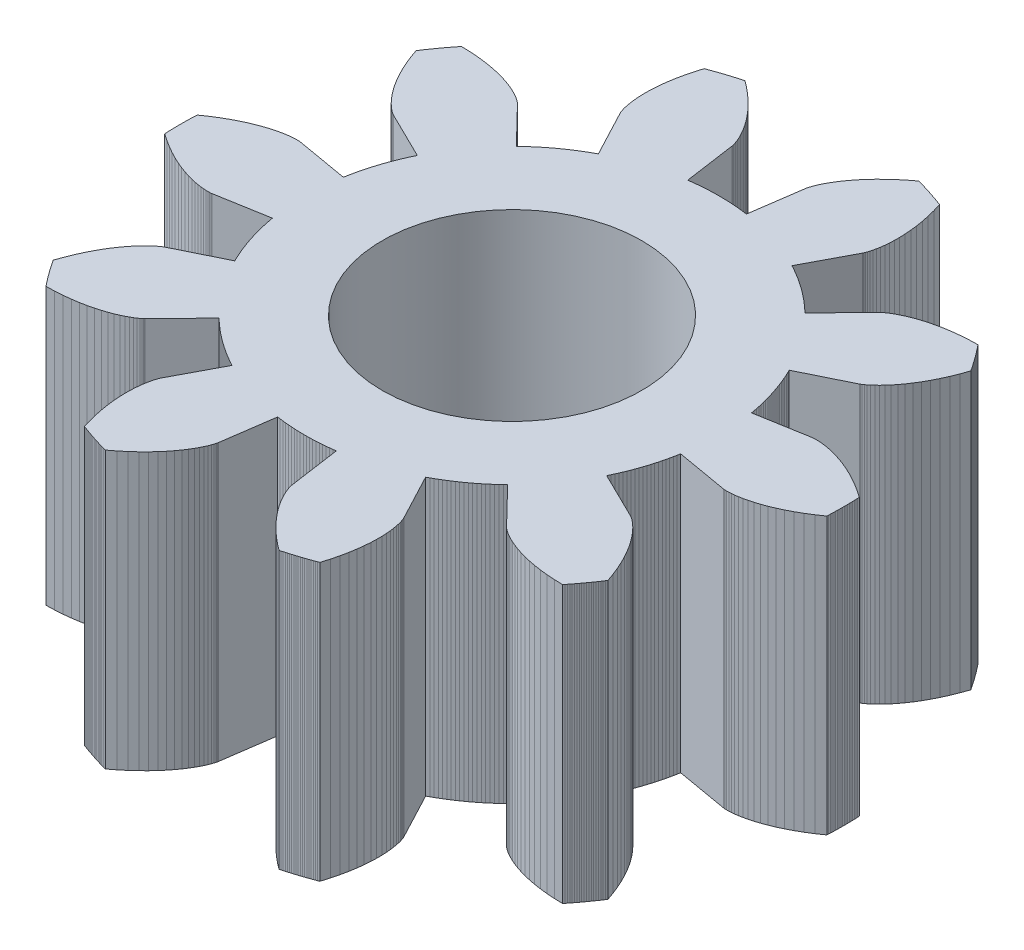
from build123d import *

# Parameters (mm, degrees)
BOSS_EXTRUDE1_DEPTH = 5
SKETCH2_R           = 2.35
CUT_EXTRUDE1_DEPTH  = 10.722497268


with BuildPart() as part:
    # Sketch1 → Boss-Extrude1 (new body)
    with BuildSketch(Plane(origin=(0, 0, 0), x_dir=(1, 0, 0), z_dir=(0, 1, 0))):
        Polygon((3.6946769, -0.6417654), (4.6291475, -0.8040829), (4.6332094, -0.8046724), (4.6454524, -0.8059869), (4.6659298, -0.8073423), (4.6946521, -0.8080515), (4.7315867, -0.8074275), (4.7766581, -0.8047855), (4.8297479, -0.7994452), (4.8906949, -0.7907331), (4.9592959, -0.7779854), (5.035306, -0.7605497), (5.1184393, -0.7377878), (5.2083696, -0.7090775), (5.3047313, -0.6738155), (5.4071205, -0.631419), (5.515096, -0.5813282), (5.6281806, -0.523008), (5.7458624, -0.4559506), (5.8675963, -0.379677), (5.9928055, -0.2937389), (5.9942402, -0.26284), (5.9955155, -0.2319341), (5.9966316, -0.201022), (5.9975882, -0.1701046), (5.9983855, -0.1391826), (5.9990233, -0.108257), (5.9995017, -0.0773285), (5.9998206, -0.0463979), (5.9999801, -0.0154661), (5.9999801, 0.0154661), (5.9998206, 0.0463979), (5.9995017, 0.0773285), (5.9990233, 0.108257), (5.9983855, 0.1391826), (5.9975882, 0.1701046), (5.9966316, 0.201022), (5.9955155, 0.2319341), (5.9942402, 0.26284), (5.9928055, 0.2937389), (5.8675963, 0.379677), (5.7458624, 0.4559506), (5.6281806, 0.523008), (5.515096, 0.5813282), (5.4071205, 0.631419), (5.3047313, 0.6738155), (5.2083696, 0.7090775), (5.1184393, 0.7377878), (5.035306, 0.7605497), (4.9592959, 0.7779854), (4.8906949, 0.7907331), (4.8297479, 0.7994452), (4.7766581, 0.8047855), (4.7315867, 0.8074275), (4.6946521, 0.8080515), (4.6659298, 0.8073423), (4.6454524, 0.8059869), (4.6332094, 0.8046724), (4.6291475, 0.8040829), (3.6946769, 0.6417654), (3.6846589, 0.6969853), (3.6738157, 0.7520491), (3.6621497, 0.8069445), (3.6496635, 0.8616591), (3.6363598, 0.9161808), (3.6222417, 0.9704972), (3.6073123, 1.0245963), (3.591575, 1.078466), (3.5750333, 1.132094), (3.5576909, 1.1854685), (3.5395516, 1.2385775), (3.5206196, 1.2914091), (3.5008991, 1.3439515), (3.4803944, 1.3961929), (3.4591103, 1.4481215), (3.4370514, 1.4997258), (3.4142227, 1.5509942), (3.3906294, 1.6019152), (3.3662766, 1.6524775), (4.217687, 2.0704279), (4.2213197, 2.0723385), (4.2319972, 2.0784713), (4.2493604, 2.0894111), (4.2730141, 2.1057199), (4.3025281, 2.1279343), (4.3374387, 2.156564), (4.3772502, 2.1920898), (4.4214365, 2.2349618), (4.469443, 2.2855975), (4.520688, 2.3443809), (4.5745651, 2.4116603), (4.6304448, 2.4877471), (4.6876766, 2.5729146), (4.7455911, 2.6673969), (4.8035025, 2.7713877), (4.8607101, 2.8850392), (4.9165014, 3.0084614), (4.9701537, 3.1417214), (5.0209369, 3.2848429), (5.0039356, 3.3106839), (4.9868014, 3.336437), (4.9695346, 3.3621014), (4.9521358, 3.3876764), (4.9346053, 3.4131614), (4.9169437, 3.4385557), (4.8991514, 3.4638585), (4.8812288, 3.4890694), (4.8631766, 3.5141875), (4.8449951, 3.5392121), (4.8266848, 3.5641428), (4.8082463, 3.5889787), (4.7896799, 3.6137192), (4.7709863, 3.6383636), (4.7521658, 3.6629114), (4.7332191, 3.6873618), (4.7141465, 3.7117142), (4.6949487, 3.735968), (4.6756261, 3.7601225), (4.5238166, 3.7560517), (4.3804993, 3.746205), (4.2458773, 3.7312839), (4.1201102, 3.7119964), (4.0033136, 3.6890544), (3.8955589, 3.663171), (3.7968742, 3.6350586), (3.7072436, 3.605426), (3.6266082, 3.5749763), (3.5548663, 3.5444044), (3.491874, 3.5143949), (3.437446, 3.4856193), (3.3913565, 3.4587344), (3.3533401, 3.4343795), (3.3230926, 3.4131746), (3.3002726, 3.3957183), (3.2845027, 3.3825855), (3.2753706, 3.3743258), (3.2724309, 3.3714613), (2.6118362, 2.6908757), (2.571274, 2.7296611), (2.530136, 2.7678352), (2.4884313, 2.8053894), (2.4461693, 2.8423152), (2.4033593, 2.8786045), (2.3600111, 2.914249), (2.3161344, 2.9492408), (2.2717388, 2.9835721), (2.2268345, 3.0172352), (2.1814314, 3.0502224), (2.1355398, 3.0825265), (2.0891698, 3.1141402), (2.042332, 3.1450565), (1.9950367, 3.1752683), (1.9472946, 3.2047689), (1.8991163, 3.2335518), (1.8505127, 3.2616105), (1.8014946, 3.2889386), (1.7520731, 3.3155301), (2.1952135, 4.1541056), (2.1970294, 4.1577866), (2.2020629, 4.1690241), (2.2096797, 4.1880805), (2.2192299, 4.2151778), (2.2300499, 4.2504976), (2.2414651, 4.2941794), (2.2527917, 4.346321), (2.2633397, 4.4069772), (2.2724148, 4.4761599), (2.2793209, 4.5538378), (2.2833626, 4.6399361), (2.2838475, 4.7343368), (2.2800888, 4.8368788), (2.2714073, 4.9473579), (2.2571343, 5.0655277), (2.2366136, 5.1910994), (2.2092039, 5.3237434), (2.1742812, 5.463089), (2.1312411, 5.6087264), (2.1022978, 5.6196391), (2.0732986, 5.6304025), (2.0442444, 5.6410163), (2.0151358, 5.6514801), (1.9859736, 5.6617938), (1.9567587, 5.6719569), (1.9274917, 5.6819693), (1.8981736, 5.6918307), (1.868805, 5.7015408), (1.8393867, 5.7110994), (1.8099195, 5.7205062), (1.7804042, 5.729761), (1.7508416, 5.7388634), (1.7212325, 5.7478134), (1.6915776, 5.7566106), (1.6618778, 5.7652547), (1.6321338, 5.7737457), (1.6023464, 5.7820832), (1.5725164, 5.790267), (1.4520927, 5.6977423), (1.3419343, 5.6055363), (1.2417933, 5.5143362), (1.1513824, 5.4248082), (1.0703769, 5.3375964), (0.9984155, 5.2533197), (0.9351019, 5.1725708), (0.8800069, 5.095914), (0.8326693, 5.0238834), (0.7925986, 4.9569814), (0.7592759, 4.8956772), (0.7321566, 4.8404053), (0.710672, 4.7915643), (0.6942315, 4.7495152), (0.6822246, 4.7145811), (0.6740235, 4.6870454), (0.6689846, 4.6671514), (0.6664515, 4.6551015), (0.6657569, 4.6510561), (0.5313628, 3.7121629), (0.4757498, 3.7196992), (0.4200303, 3.7264024), (0.3642167, 3.7322709), (0.3083215, 3.7373036), (0.2523573, 3.7414991), (0.1963365, 3.7448567), (0.1402718, 3.7473756), (0.0841756, 3.7490551), (0.0280606, 3.749895), (-0.0280606, 3.749895), (-0.0841756, 3.7490551), (-0.1402718, 3.7473756), (-0.1963365, 3.7448567), (-0.2523573, 3.7414991), (-0.3083215, 3.7373036), (-0.3642167, 3.7322709), (-0.4200303, 3.7264024), (-0.4757498, 3.7196992), (-0.5313628, 3.7121629), (-0.6657569, 4.6510561), (-0.6664515, 4.6551015), (-0.6689846, 4.6671514), (-0.6740235, 4.6870454), (-0.6822246, 4.7145811), (-0.6942315, 4.7495152), (-0.710672, 4.7915643), (-0.7321566, 4.8404053), (-0.7592759, 4.8956772), (-0.7925986, 4.9569814), (-0.8326693, 5.0238834), (-0.8800069, 5.095914), (-0.9351019, 5.1725708), (-0.9984155, 5.2533197), (-1.0703769, 5.3375964), (-1.1513824, 5.4248082), (-1.2417933, 5.5143362), (-1.3419343, 5.6055363), (-1.4520927, 5.6977423), (-1.5725164, 5.790267), (-1.6023464, 5.7820832), (-1.6321338, 5.7737457), (-1.6618778, 5.7652547), (-1.6915776, 5.7566106), (-1.7212325, 5.7478134), (-1.7508416, 5.7388634), (-1.7804042, 5.729761), (-1.8099195, 5.7205062), (-1.8393867, 5.7110994), (-1.868805, 5.7015408), (-1.8981736, 5.6918307), (-1.9274917, 5.6819693), (-1.9567587, 5.6719569), (-1.9859736, 5.6617938), (-2.0151358, 5.6514801), (-2.0442444, 5.6410163), (-2.0732986, 5.6304025), (-2.1022978, 5.6196391), (-2.1312411, 5.6087264), (-2.1742812, 5.463089), (-2.2092039, 5.3237434), (-2.2366136, 5.1910994), (-2.2571343, 5.0655277), (-2.2714073, 4.9473579), (-2.2800888, 4.8368788), (-2.2838475, 4.7343368), (-2.2833626, 4.6399361), (-2.2793209, 4.5538378), (-2.2724148, 4.4761599), (-2.2633397, 4.4069772), (-2.2527917, 4.346321), (-2.2414651, 4.2941794), (-2.2300499, 4.2504976), (-2.2192299, 4.2151778), (-2.2096797, 4.1880805), (-2.2020629, 4.1690241), (-2.1970294, 4.1577866), (-2.1952135, 4.1541056), (-1.7520731, 3.3155301), (-1.8014946, 3.2889386), (-1.8505127, 3.2616105), (-1.8991163, 3.2335518), (-1.9472946, 3.2047689), (-1.9950367, 3.1752683), (-2.042332, 3.1450565), (-2.0891698, 3.1141402), (-2.1355398, 3.0825265), (-2.1814314, 3.0502224), (-2.2268345, 3.0172352), (-2.2717388, 2.9835721), (-2.3161344, 2.9492408), (-2.3600111, 2.914249), (-2.4033593, 2.8786045), (-2.4461693, 2.8423152), (-2.4884313, 2.8053894), (-2.530136, 2.7678352), (-2.571274, 2.7296611), (-2.6118362, 2.6908757), (-3.2724309, 3.3714613), (-3.2753706, 3.3743258), (-3.2845027, 3.3825855), (-3.3002726, 3.3957183), (-3.3230926, 3.4131746), (-3.3533401, 3.4343795), (-3.3913565, 3.4587344), (-3.437446, 3.4856193), (-3.491874, 3.5143949), (-3.5548663, 3.5444044), (-3.6266082, 3.5749763), (-3.7072436, 3.605426), (-3.7968742, 3.6350586), (-3.8955589, 3.663171), (-4.0033136, 3.6890544), (-4.1201102, 3.7119964), (-4.2458773, 3.7312839), (-4.3804993, 3.746205), (-4.5238166, 3.7560517), (-4.6756261, 3.7601225), (-4.6949487, 3.735968), (-4.7141465, 3.7117142), (-4.7332191, 3.6873618), (-4.7521658, 3.6629114), (-4.7709863, 3.6383636), (-4.7896799, 3.6137192), (-4.8082463, 3.5889787), (-4.8266848, 3.5641428), (-4.8449951, 3.5392121), (-4.8631766, 3.5141875), (-4.8812288, 3.4890694), (-4.8991514, 3.4638585), (-4.9169437, 3.4385557), (-4.9346053, 3.4131614), (-4.9521358, 3.3876764), (-4.9695346, 3.3621014), (-4.9868014, 3.336437), (-5.0039356, 3.3106839), (-5.0209369, 3.2848429), (-4.9701537, 3.1417214), (-4.9165014, 3.0084614), (-4.8607101, 2.8850392), (-4.8035025, 2.7713877), (-4.7455911, 2.6673969), (-4.6876766, 2.5729146), (-4.6304448, 2.4877471), (-4.5745651, 2.4116603), (-4.520688, 2.3443809), (-4.469443, 2.2855975), (-4.4214365, 2.2349618), (-4.3772502, 2.1920898), (-4.3374387, 2.156564), (-4.3025281, 2.1279343), (-4.2730141, 2.1057199), (-4.2493604, 2.0894111), (-4.2319972, 2.0784713), (-4.2213197, 2.0723385), (-4.217687, 2.0704279), (-3.3662766, 1.6524775), (-3.3906294, 1.6019152), (-3.4142227, 1.5509942), (-3.4370514, 1.4997258), (-3.4591103, 1.4481215), (-3.4803944, 1.3961929), (-3.5008991, 1.3439515), (-3.5206196, 1.2914091), (-3.5395516, 1.2385775), (-3.5576909, 1.1854685), (-3.5750333, 1.132094), (-3.591575, 1.078466), (-3.6073123, 1.0245963), (-3.6222417, 0.9704972), (-3.6363598, 0.9161808), (-3.6496635, 0.8616591), (-3.6621497, 0.8069445), (-3.6738157, 0.7520491), (-3.6846589, 0.6969853), (-3.6946769, 0.6417654), (-4.6291475, 0.8040829), (-4.6332094, 0.8046724), (-4.6454524, 0.8059869), (-4.6659298, 0.8073423), (-4.6946521, 0.8080515), (-4.7315867, 0.8074275), (-4.7766581, 0.8047855), (-4.8297479, 0.7994452), (-4.8906949, 0.7907331), (-4.9592959, 0.7779854), (-5.035306, 0.7605497), (-5.1184393, 0.7377878), (-5.2083696, 0.7090775), (-5.3047313, 0.6738155), (-5.4071205, 0.631419), (-5.515096, 0.5813282), (-5.6281806, 0.523008), (-5.7458624, 0.4559506), (-5.8675963, 0.379677), (-5.9928055, 0.2937389), (-5.9942402, 0.26284), (-5.9955155, 0.2319341), (-5.9966316, 0.201022), (-5.9975882, 0.1701046), (-5.9983855, 0.1391826), (-5.9990233, 0.108257), (-5.9995017, 0.0773285), (-5.9998206, 0.0463979), (-5.9999801, 0.0154661), (-5.9999801, -0.0154661), (-5.9998206, -0.0463979), (-5.9995017, -0.0773285), (-5.9990233, -0.108257), (-5.9983855, -0.1391826), (-5.9975882, -0.1701046), (-5.9966316, -0.201022), (-5.9955155, -0.2319341), (-5.9942402, -0.26284), (-5.9928055, -0.2937389), (-5.8675963, -0.379677), (-5.7458624, -0.4559506), (-5.6281806, -0.523008), (-5.515096, -0.5813282), (-5.4071205, -0.631419), (-5.3047313, -0.6738155), (-5.2083696, -0.7090775), (-5.1184393, -0.7377878), (-5.035306, -0.7605497), (-4.9592959, -0.7779854), (-4.8906949, -0.7907331), (-4.8297479, -0.7994452), (-4.7766581, -0.8047855), (-4.7315867, -0.8074275), (-4.6946521, -0.8080515), (-4.6659298, -0.8073423), (-4.6454524, -0.8059869), (-4.6332094, -0.8046724), (-4.6291475, -0.8040829), (-3.6946769, -0.6417654), (-3.6846589, -0.6969853), (-3.6738157, -0.7520491), (-3.6621497, -0.8069445), (-3.6496635, -0.8616591), (-3.6363598, -0.9161808), (-3.6222417, -0.9704972), (-3.6073123, -1.0245963), (-3.591575, -1.078466), (-3.5750333, -1.132094), (-3.5576909, -1.1854685), (-3.5395516, -1.2385775), (-3.5206196, -1.2914091), (-3.5008991, -1.3439515), (-3.4803944, -1.3961929), (-3.4591103, -1.4481215), (-3.4370514, -1.4997258), (-3.4142227, -1.5509942), (-3.3906294, -1.6019152), (-3.3662766, -1.6524775), (-4.217687, -2.0704279), (-4.2213197, -2.0723385), (-4.2319972, -2.0784713), (-4.2493604, -2.0894111), (-4.2730141, -2.1057199), (-4.3025281, -2.1279343), (-4.3374387, -2.156564), (-4.3772502, -2.1920898), (-4.4214365, -2.2349618), (-4.469443, -2.2855975), (-4.520688, -2.3443809), (-4.5745651, -2.4116603), (-4.6304448, -2.4877471), (-4.6876766, -2.5729146), (-4.7455911, -2.6673969), (-4.8035025, -2.7713877), (-4.8607101, -2.8850392), (-4.9165014, -3.0084614), (-4.9701537, -3.1417214), (-5.0209369, -3.2848429), (-5.0039356, -3.3106839), (-4.9868014, -3.336437), (-4.9695346, -3.3621014), (-4.9521358, -3.3876764), (-4.9346053, -3.4131614), (-4.9169437, -3.4385557), (-4.8991514, -3.4638585), (-4.8812288, -3.4890694), (-4.8631766, -3.5141875), (-4.8449951, -3.5392121), (-4.8266848, -3.5641428), (-4.8082463, -3.5889787), (-4.7896799, -3.6137192), (-4.7709863, -3.6383636), (-4.7521658, -3.6629114), (-4.7332191, -3.6873618), (-4.7141465, -3.7117142), (-4.6949487, -3.735968), (-4.6756261, -3.7601225), (-4.5238166, -3.7560517), (-4.3804993, -3.746205), (-4.2458773, -3.7312839), (-4.1201102, -3.7119964), (-4.0033136, -3.6890544), (-3.8955589, -3.663171), (-3.7968742, -3.6350586), (-3.7072436, -3.605426), (-3.6266082, -3.5749763), (-3.5548663, -3.5444044), (-3.491874, -3.5143949), (-3.437446, -3.4856193), (-3.3913565, -3.4587344), (-3.3533401, -3.4343795), (-3.3230926, -3.4131746), (-3.3002726, -3.3957183), (-3.2845027, -3.3825855), (-3.2753706, -3.3743258), (-3.2724309, -3.3714613), (-2.6118362, -2.6908757), (-2.571274, -2.7296611), (-2.530136, -2.7678352), (-2.4884313, -2.8053894), (-2.4461693, -2.8423152), (-2.4033593, -2.8786045), (-2.3600111, -2.914249), (-2.3161344, -2.9492408), (-2.2717388, -2.9835721), (-2.2268345, -3.0172352), (-2.1814314, -3.0502224), (-2.1355398, -3.0825265), (-2.0891698, -3.1141402), (-2.042332, -3.1450565), (-1.9950367, -3.1752683), (-1.9472946, -3.2047689), (-1.8991163, -3.2335518), (-1.8505127, -3.2616105), (-1.8014946, -3.2889386), (-1.7520731, -3.3155301), (-2.1952135, -4.1541056), (-2.1970294, -4.1577866), (-2.2020629, -4.1690241), (-2.2096797, -4.1880805), (-2.2192299, -4.2151778), (-2.2300499, -4.2504976), (-2.2414651, -4.2941794), (-2.2527917, -4.346321), (-2.2633397, -4.4069772), (-2.2724148, -4.4761599), (-2.2793209, -4.5538378), (-2.2833626, -4.6399361), (-2.2838475, -4.7343368), (-2.2800888, -4.8368788), (-2.2714073, -4.9473579), (-2.2571343, -5.0655277), (-2.2366136, -5.1910994), (-2.2092039, -5.3237434), (-2.1742812, -5.463089), (-2.1312411, -5.6087264), (-2.1022978, -5.6196391), (-2.0732986, -5.6304025), (-2.0442444, -5.6410163), (-2.0151358, -5.6514801), (-1.9859736, -5.6617938), (-1.9567587, -5.6719569), (-1.9274917, -5.6819693), (-1.8981736, -5.6918307), (-1.868805, -5.7015408), (-1.8393867, -5.7110994), (-1.8099195, -5.7205062), (-1.7804042, -5.729761), (-1.7508416, -5.7388634), (-1.7212325, -5.7478134), (-1.6915776, -5.7566106), (-1.6618778, -5.7652547), (-1.6321338, -5.7737457), (-1.6023464, -5.7820832), (-1.5725164, -5.790267), (-1.4520927, -5.6977423), (-1.3419343, -5.6055363), (-1.2417933, -5.5143362), (-1.1513824, -5.4248082), (-1.0703769, -5.3375964), (-0.9984155, -5.2533197), (-0.9351019, -5.1725708), (-0.8800069, -5.095914), (-0.8326693, -5.0238834), (-0.7925986, -4.9569814), (-0.7592759, -4.8956772), (-0.7321566, -4.8404053), (-0.710672, -4.7915643), (-0.6942315, -4.7495152), (-0.6822246, -4.7145811), (-0.6740235, -4.6870454), (-0.6689846, -4.6671514), (-0.6664515, -4.6551015), (-0.6657569, -4.6510561), (-0.5313628, -3.7121629), (-0.4757498, -3.7196992), (-0.4200303, -3.7264024), (-0.3642167, -3.7322709), (-0.3083215, -3.7373036), (-0.2523573, -3.7414991), (-0.1963365, -3.7448567), (-0.1402718, -3.7473756), (-0.0841756, -3.7490551), (-0.0280606, -3.749895), (0.0280606, -3.749895), (0.0841756, -3.7490551), (0.1402718, -3.7473756), (0.1963365, -3.7448567), (0.2523573, -3.7414991), (0.3083215, -3.7373036), (0.3642167, -3.7322709), (0.4200303, -3.7264024), (0.4757498, -3.7196992), (0.5313628, -3.7121629), (0.6657569, -4.6510561), (0.6664515, -4.6551015), (0.6689846, -4.6671514), (0.6740235, -4.6870454), (0.6822246, -4.7145811), (0.6942315, -4.7495152), (0.710672, -4.7915643), (0.7321566, -4.8404053), (0.7592759, -4.8956772), (0.7925986, -4.9569814), (0.8326693, -5.0238834), (0.8800069, -5.095914), (0.9351019, -5.1725708), (0.9984155, -5.2533197), (1.0703769, -5.3375964), (1.1513824, -5.4248082), (1.2417933, -5.5143362), (1.3419343, -5.6055363), (1.4520927, -5.6977423), (1.5725164, -5.790267), (1.6023464, -5.7820832), (1.6321338, -5.7737457), (1.6618778, -5.7652547), (1.6915776, -5.7566106), (1.7212325, -5.7478134), (1.7508416, -5.7388634), (1.7804042, -5.729761), (1.8099195, -5.7205062), (1.8393867, -5.7110994), (1.868805, -5.7015408), (1.8981736, -5.6918307), (1.9274917, -5.6819693), (1.9567587, -5.6719569), (1.9859736, -5.6617938), (2.0151358, -5.6514801), (2.0442444, -5.6410163), (2.0732986, -5.6304025), (2.1022978, -5.6196391), (2.1312411, -5.6087264), (2.1742812, -5.463089), (2.2092039, -5.3237434), (2.2366136, -5.1910994), (2.2571343, -5.0655277), (2.2714073, -4.9473579), (2.2800888, -4.8368788), (2.2838475, -4.7343368), (2.2833626, -4.6399361), (2.2793209, -4.5538378), (2.2724148, -4.4761599), (2.2633397, -4.4069772), (2.2527917, -4.346321), (2.2414651, -4.2941794), (2.2300499, -4.2504976), (2.2192299, -4.2151778), (2.2096797, -4.1880805), (2.2020629, -4.1690241), (2.1970294, -4.1577866), (2.1952135, -4.1541056), (1.7520731, -3.3155301), (1.8014946, -3.2889386), (1.8505127, -3.2616105), (1.8991163, -3.2335518), (1.9472946, -3.2047689), (1.9950367, -3.1752683), (2.042332, -3.1450565), (2.0891698, -3.1141402), (2.1355398, -3.0825265), (2.1814314, -3.0502224), (2.2268345, -3.0172352), (2.2717388, -2.9835721), (2.3161344, -2.9492408), (2.3600111, -2.914249), (2.4033593, -2.8786045), (2.4461693, -2.8423152), (2.4884313, -2.8053894), (2.530136, -2.7678352), (2.571274, -2.7296611), (2.6118362, -2.6908757), (3.2724309, -3.3714613), (3.2753706, -3.3743258), (3.2845027, -3.3825855), (3.3002726, -3.3957183), (3.3230926, -3.4131746), (3.3533401, -3.4343795), (3.3913565, -3.4587344), (3.437446, -3.4856193), (3.491874, -3.5143949), (3.5548663, -3.5444044), (3.6266082, -3.5749763), (3.7072436, -3.605426), (3.7968742, -3.6350586), (3.8955589, -3.663171), (4.0033136, -3.6890544), (4.1201102, -3.7119964), (4.2458773, -3.7312839), (4.3804993, -3.746205), (4.5238166, -3.7560517), (4.6756261, -3.7601225), (4.6949487, -3.735968), (4.7141465, -3.7117142), (4.7332191, -3.6873618), (4.7521658, -3.6629114), (4.7709863, -3.6383636), (4.7896799, -3.6137192), (4.8082463, -3.5889787), (4.8266848, -3.5641428), (4.8449951, -3.5392121), (4.8631766, -3.5141875), (4.8812288, -3.4890694), (4.8991514, -3.4638585), (4.9169437, -3.4385557), (4.9346053, -3.4131614), (4.9521358, -3.3876764), (4.9695346, -3.3621014), (4.9868014, -3.336437), (5.0039356, -3.3106839), (5.0209369, -3.2848429), (4.9701537, -3.1417214), (4.9165014, -3.0084614), (4.8607101, -2.8850392), (4.8035025, -2.7713877), (4.7455911, -2.6673969), (4.6876766, -2.5729146), (4.6304448, -2.4877471), (4.5745651, -2.4116603), (4.520688, -2.3443809), (4.469443, -2.2855975), (4.4214365, -2.2349618), (4.3772502, -2.1920898), (4.3374387, -2.156564), (4.3025281, -2.1279343), (4.2730141, -2.1057199), (4.2493604, -2.0894111), (4.2319972, -2.0784713), (4.2213197, -2.0723385), (4.217687, -2.0704279), (3.3662766, -1.6524775), (3.3906294, -1.6019152), (3.4142227, -1.5509942), (3.4370514, -1.4997258), (3.4591103, -1.4481215), (3.4803944, -1.3961929), (3.5008991, -1.3439515), (3.5206196, -1.2914091), (3.5395516, -1.2385775), (3.5576909, -1.1854685), (3.5750333, -1.132094), (3.591575, -1.078466), (3.6073123, -1.0245963), (3.6222417, -0.9704972), (3.6363598, -0.9161808), (3.6496635, -0.8616591), (3.6621497, -0.8069445), (3.6738157, -0.7520491), (3.6846589, -0.6969853), align=None)
    extrude(amount=BOSS_EXTRUDE1_DEPTH)

    # Sketch2 → Cut-Extrude1 (cut, through all)
    with BuildSketch(Plane(origin=(0, 5, 0), x_dir=(1, 0, 0), z_dir=(0, 1, 0))):
        Circle(SKETCH2_R)
    extrude(amount=-CUT_EXTRUDE1_DEPTH, mode=Mode.SUBTRACT)


solid = part.part
